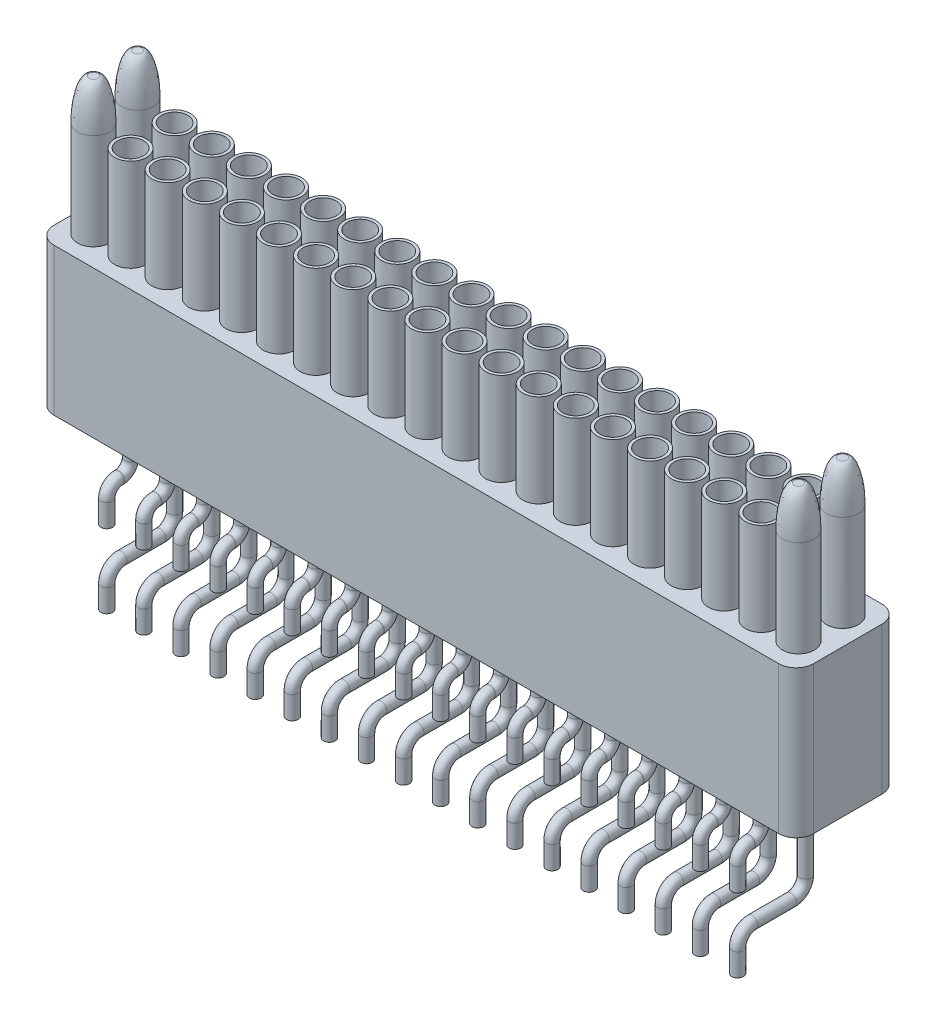
from build123d import *

# Parameters (mm, degrees)
SKETCH1_W                   = 13.1
SKETCH1_H                   = 2.54
BOSS_EXTRUDE1_DEPTH         = 1.78
SKETCH2_R                   = 0.275
SKETCH2_R_2                 = 0.225
BOSS_EXTRUDE2_DEPTH         = 1.6
LPATTERN1_COUNT             = 10
LPATTERN1_PITCH             = 0.64
LPATTERN1_COUNT_DIR2        = 2
LPATTERN1_PITCH_DIR2        = 0.76
LPATTERN2_COUNT             = 9
LPATTERN2_PITCH             = 0.64
LPATTERN2_COUNT_DIR2        = 2
LPATTERN2_PITCH_DIR2        = 0.76
SKETCH4_R                   = 0.1
SKETCH7_R                   = 0.1
LPATTERN3_COUNT             = 18
LPATTERN3_PITCH             = 0.64
SKETCH8_R                   = 0.275
BOSS_EXTRUDE3_DEPTH         = 2.36
FILLET1_SIZE                = 0.7
FILLET1_SIZE_2              = 0.2
LPATTERN5_COUNT             = 2
LPATTERN5_PITCH             = 12.16
LPATTERN5_COUNT_DIR2        = 2
LPATTERN5_PITCH_DIR2        = 0.76
FILLET1_OF_LPATTERN5_SIZE   = 0.7
FILLET1_OF_LPATTERN5_SIZE_2 = 0.2
FILLET2_R                   = 0.3


with BuildPart() as part:
    # Sketch1 → Boss-Extrude1 (new body)
    with BuildSketch(Plane.XY):
        Rectangle(SKETCH1_W, SKETCH1_H)
    extrude(amount=BOSS_EXTRUDE1_DEPTH)

    # Sketch2 → Boss-Extrude2 (add)
    with BuildSketch(Plane(origin=(0, 1.27, 0), x_dir=(1, 0, 0), z_dir=(0, 1, 0))):
        with Locations(Location((-0.32, -0.51, 0), (0, 0, 270))):
            Circle(SKETCH2_R)
        with Locations(Location((-0.32, -0.51, 0), (0, 0, 270))):
            Circle(SKETCH2_R_2, mode=Mode.SUBTRACT)
    boss_extrude2 = extrude(amount=BOSS_EXTRUDE2_DEPTH)

    # LPattern1: Boss-Extrude2 10 × 2
    with Locations(*[(i * LPATTERN1_PITCH, 0, j * LPATTERN1_PITCH_DIR2) for i in range(LPATTERN1_COUNT) for j in range(LPATTERN1_COUNT_DIR2) if (i, j) != (0, 0)]):
        add(boss_extrude2)

    # LPattern2: Boss-Extrude2 9 × 2
    with Locations(*[(-i * LPATTERN2_PITCH, 0, j * LPATTERN2_PITCH_DIR2) for i in range(LPATTERN2_COUNT) for j in range(LPATTERN2_COUNT_DIR2) if (i, j) != (0, 0)]):
        add(boss_extrude2)

    # Sweep2: sweep along a path in Sketch3
    with BuildLine(Plane.ZY.offset(5.44)) as sweep2_path:
        Line((0.51, -1.27), (0.51, -2.92))
        ThreePointArc((0.51, -2.92), (0.583223305, -3.096776695), (0.76, -3.17))
        Line((0.76, -3.17), (1.43, -3.17))
        ThreePointArc((1.43, -3.17), (1.606776695, -3.243223305), (1.68, -3.42))
        Line((1.68, -3.42), (1.68, -3.81))
    # Sketch4 → Sweep2 (sweep)
    with BuildSketch(Plane.XZ.offset(1.27)):
        with Locations((-5.44, 0.51)):
            Circle(SKETCH4_R)
    sweep2 = sweep(path=sweep2_path.line)

    # Sweep3: sweep along a path in Sketch6
    with BuildLine(Plane.ZY.offset(5.44)) as sweep3_path:
        Line((1.271296199, -1.27), (1.271296199, -1.748154473))
        ThreePointArc((1.271296199, -1.748154473), (1.329874843, -1.88957583), (1.471296199, -1.948154473))
        Line((1.471296199, -1.948154473), (1.48, -1.948154473))
        ThreePointArc((1.48, -1.948154473), (1.621421356, -2.006733117), (1.68, -2.148154473))
        Line((1.68, -2.148154473), (1.68, -2.54))
    # Sketch7 → Sweep3 (sweep)
    with BuildSketch(Plane(origin=(0, -1.27, 0), x_dir=(-1, 0, 0), z_dir=(0, -1, 0))):
        with Locations((5.44, -1.271296199)):
            Circle(SKETCH7_R)
    sweep3 = sweep(path=sweep3_path.line)

    # LPattern3: Sweep2, Sweep3 ×18
    with Locations(*[(i * LPATTERN3_PITCH, 0, 0) for i in range(1, LPATTERN3_COUNT)]):
        add(sweep2)
        add(sweep3)

    # Sketch8 → Boss-Extrude3 (add)
    with BuildSketch(Plane(origin=(0, 1.27, 0), x_dir=(1, 0, 0), z_dir=(0, 1, 0))):
        with Locations(Location((6.08, -0.51, 0), (0, 0, 270))):
            Circle(SKETCH8_R)
    boss_extrude3 = extrude(amount=BOSS_EXTRUDE3_DEPTH)

    # Fillet1
    # an asymmetric fillet: 0.7, 0.2 mm, written as the material it takes off along each edge
    with BuildSketch(Plane(origin=(6.08, 3.63, 0.51), x_dir=(0, 0, 1), z_dir=(-1, 0, 0))) as fillet1_piece_1:
        with BuildLine():
            Bezier((0.275, -FILLET1_SIZE), (0.275, 0), (0.275 - FILLET1_SIZE_2, 0), weights=[1, 0.707106781, 1])
            Line((0.275 - FILLET1_SIZE_2, 0), (0.275, 0))
            Line((0.275, 0), (0.275, -FILLET1_SIZE))
        make_face()
    revolve(axis=Axis((6.08, 3.63, 0.51), (0, 1, 0)), mode=Mode.SUBTRACT)

    # LPattern5: Boss-Extrude3 2 × 2
    with Locations(*[(-i * LPATTERN5_PITCH, 0, j * LPATTERN5_PITCH_DIR2) for i in range(LPATTERN5_COUNT) for j in range(LPATTERN5_COUNT_DIR2) if (i, j) != (0, 0)]):
        add(boss_extrude3)

    # Fillet1 of LPattern5
    # an asymmetric fillet: 0.7, 0.2 mm, written as the material it takes off along each edge
    with BuildSketch(Plane(origin=(6.08, 3.63, 1.27), x_dir=(0, 0, 1), z_dir=(-1, 0, 0))) as fillet1_of_lpattern5_piece_1:
        with BuildLine():
            Bezier((0.275, -FILLET1_OF_LPATTERN5_SIZE), (0.275, 0), (0.275 - FILLET1_OF_LPATTERN5_SIZE_2, 0), weights=[1, 0.707106781, 1])
            Line((0.275 - FILLET1_OF_LPATTERN5_SIZE_2, 0), (0.275, 0))
            Line((0.275, 0), (0.275, -FILLET1_OF_LPATTERN5_SIZE))
        make_face()
    revolve(axis=Axis((6.08, 3.63, 1.27), (0, 1, 0)), mode=Mode.SUBTRACT)
    with BuildSketch(Plane(origin=(-6.08, 3.63, 0.51), x_dir=(0, 0, 1), z_dir=(-1, 0, 0))) as fillet1_of_lpattern5_piece_2:
        with BuildLine():
            Bezier((0.275, -FILLET1_OF_LPATTERN5_SIZE), (0.275, 0), (0.275 - FILLET1_OF_LPATTERN5_SIZE_2, 0), weights=[1, 0.707106781, 1])
            Line((0.275 - FILLET1_OF_LPATTERN5_SIZE_2, 0), (0.275, 0))
            Line((0.275, 0), (0.275, -FILLET1_OF_LPATTERN5_SIZE))
        make_face()
    revolve(axis=Axis((-6.08, 3.63, 0.51), (0, 1, 0)), mode=Mode.SUBTRACT)
    with BuildSketch(Plane(origin=(-6.08, 3.63, 1.27), x_dir=(0, 0, 1), z_dir=(-1, 0, 0))) as fillet1_of_lpattern5_piece_3:
        with BuildLine():
            Bezier((0.275, -FILLET1_OF_LPATTERN5_SIZE), (0.275, 0), (0.275 - FILLET1_OF_LPATTERN5_SIZE_2, 0), weights=[1, 0.707106781, 1])
            Line((0.275 - FILLET1_OF_LPATTERN5_SIZE_2, 0), (0.275, 0))
            Line((0.275, 0), (0.275, -FILLET1_OF_LPATTERN5_SIZE))
        make_face()
    revolve(axis=Axis((-6.08, 3.63, 1.27), (0, 1, 0)), mode=Mode.SUBTRACT)

    # Fillet2
    fillet2_edges = [part.edges().sort_by_distance(p)[0] for p in [
        (6.55, 0, 1.78),
        (-6.55, 0, 1.78),
        (6.55, 0, 0),
        (-6.55, 0, 0),
    ]]
    fillet(fillet2_edges, radius=FILLET2_R)


solid = part.part
